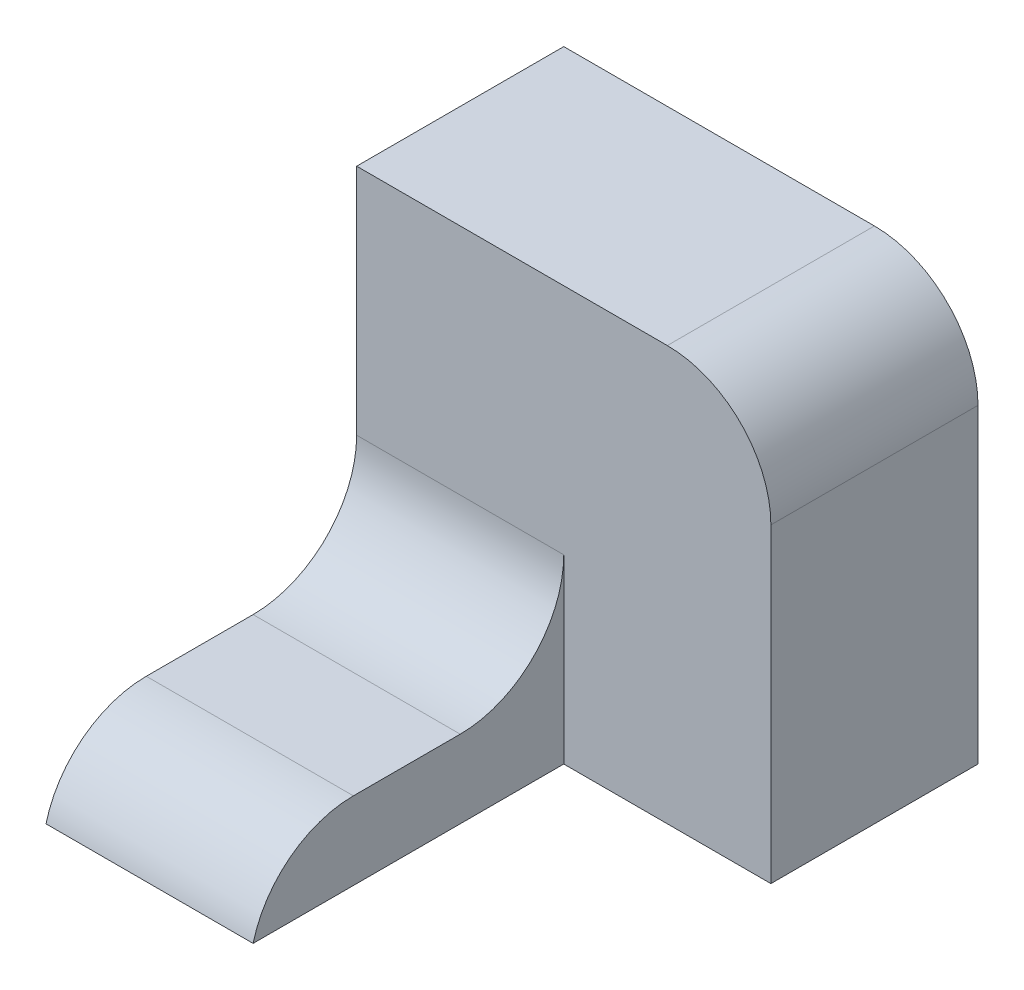
from build123d import *

# Parameters (mm, degrees)
SKETCH1_W           = 20
SKETCH1_H           = 7.5
BOSS_EXTRUDE1_DEPTH = 30
SKETCH2_W           = 40
SKETCH2_H           = 40
BOSS_EXTRUDE2_DEPTH = 20
FILLET1_R           = 10


with BuildPart() as part:
    # Sketch1 → Boss-Extrude1 (new body)
    with BuildSketch(Plane.XY):
        with Locations((-20, -3.75)):
            Rectangle(SKETCH1_W, SKETCH1_H)
    extrude(amount=BOSS_EXTRUDE1_DEPTH)

    # Sketch2 → Boss-Extrude2 (add)
    with BuildSketch(Plane.XY):
        with Locations((-10, 12.5)):
            Rectangle(SKETCH2_W, SKETCH2_H)
    extrude(amount=-BOSS_EXTRUDE2_DEPTH)

    # Fillet1
    # the kernel refuses this fillet: 10 mm, written as the material it adds along each edge
    with BuildSketch(Plane(origin=(-10, 0, 0), x_dir=(0, 1, 0), z_dir=(-1, 0, 0))) as fillet1_piece_1:
        with BuildLine():
            CenterArc((FILLET1_R, -FILLET1_R), FILLET1_R, 90, 90)
            Line((0, -FILLET1_R), (0, 0))
            Line((0, 0), (FILLET1_R, 0))
        make_face()
    extrude(amount=20)
    # the kernel refuses this fillet: 10 mm, written as the material it takes off along each edge
    with BuildSketch(Plane(origin=(10, 32.5, 25), x_dir=(-1, 0, 0), z_dir=(0, 0, -1))) as fillet1_2_piece_1:
        with BuildLine():
            CenterArc((FILLET1_R, -FILLET1_R), FILLET1_R, 90, 90)
            Line((0, -FILLET1_R), (0, 0))
            Line((0, 0), (FILLET1_R, 0))
        make_face()
    extrude(amount=70, mode=Mode.SUBTRACT)
    with BuildSketch(Plane(origin=(14.206145914, 0, 30), x_dir=(0, 0, -1), z_dir=(-1, 0, 0))) as fillet1_2_piece_2:
        with BuildLine():
            CenterArc((9.682458366, 10), FILLET1_R, 194.477512186, 75.522487814)
            Line((0, 7.5), (0, 0))
            Line((0, 0), (9.682458366, 0))
        make_face()
    extrude(amount=68.412291828, mode=Mode.SUBTRACT)


solid = part.part
